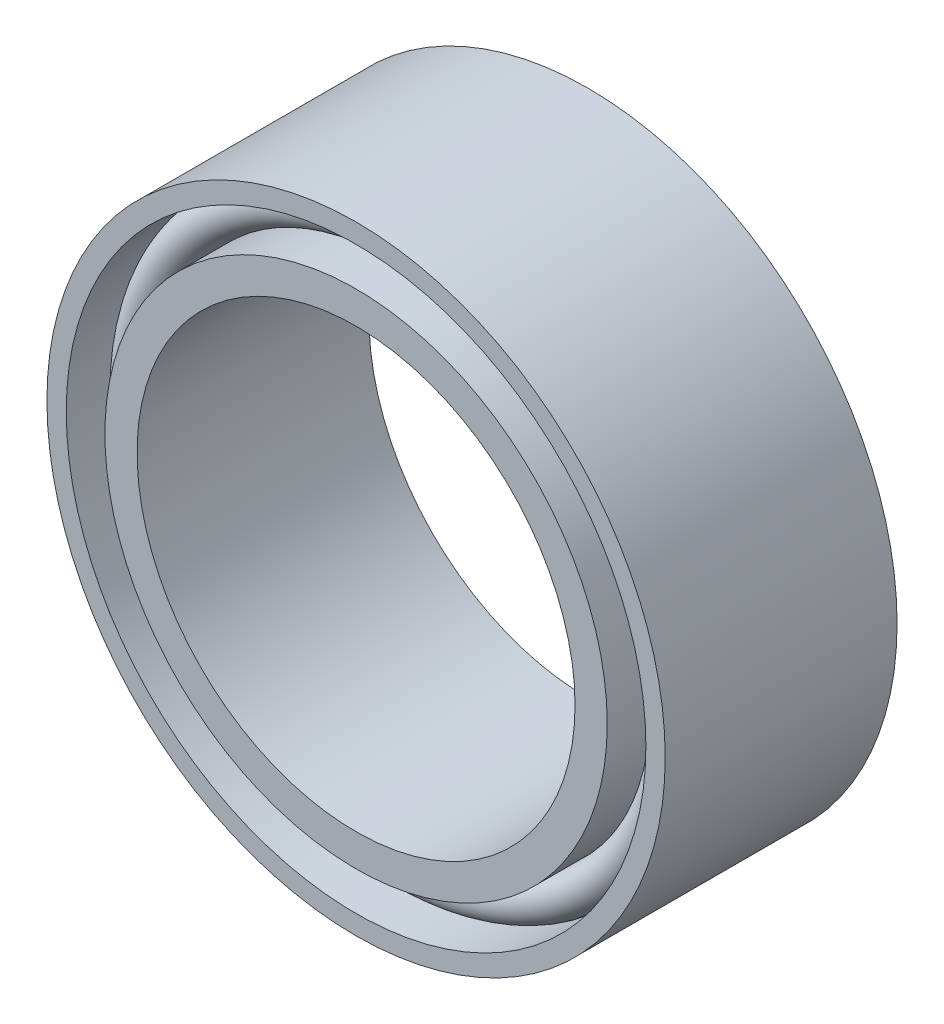
from build123d import *

# Parameters (mm, degrees)
IZIM1_R                     = 24
IZIM1_R_2                   = 22.5
Y_KSEKLIK_EKSTR_ZYON1_DEPTH = 18
IZIM2_R                     = 19.5
IZIM2_R_2                   = 17
Y_KSEKLIK_EKSTR_ZYON2_DEPTH = 18


with BuildPart() as part:
    # Çizim1 → Yükseklik-Ekstrüzyon1 (new body)
    with BuildSketch(Plane.XY):
        Circle(IZIM1_R)
        Circle(IZIM1_R_2, mode=Mode.SUBTRACT)
    extrude(amount=Y_KSEKLIK_EKSTR_ZYON1_DEPTH)

    # Çizim3 → Döndür1 (revolve)
    with BuildSketch(Plane(origin=(0, 0, 0), x_dir=(0, 0, -1), z_dir=(1, 0, 0))):
        with BuildLine():
            Line((-14, 22.5), (-4, 22.5))
            ThreePointArc((-4, 22.5), (-2.5, 21), (-4, 19.5))
            Line((-4, 19.5), (-14, 19.5))
            ThreePointArc((-14, 19.5), (-15.5, 21), (-14, 22.5))
        make_face()
    revolve(axis=Axis((0, 0, 0), (0, 0, 1)))


with BuildPart() as body_2:
    # Çizim2 → Yükseklik-Ekstrüzyon2 (new body)
    with BuildSketch(Plane.XY.offset(18)):
        Circle(IZIM2_R)
        Circle(IZIM2_R_2, mode=Mode.SUBTRACT)
    extrude(amount=-Y_KSEKLIK_EKSTR_ZYON2_DEPTH)


solid = Compound([part.part, body_2.part])
